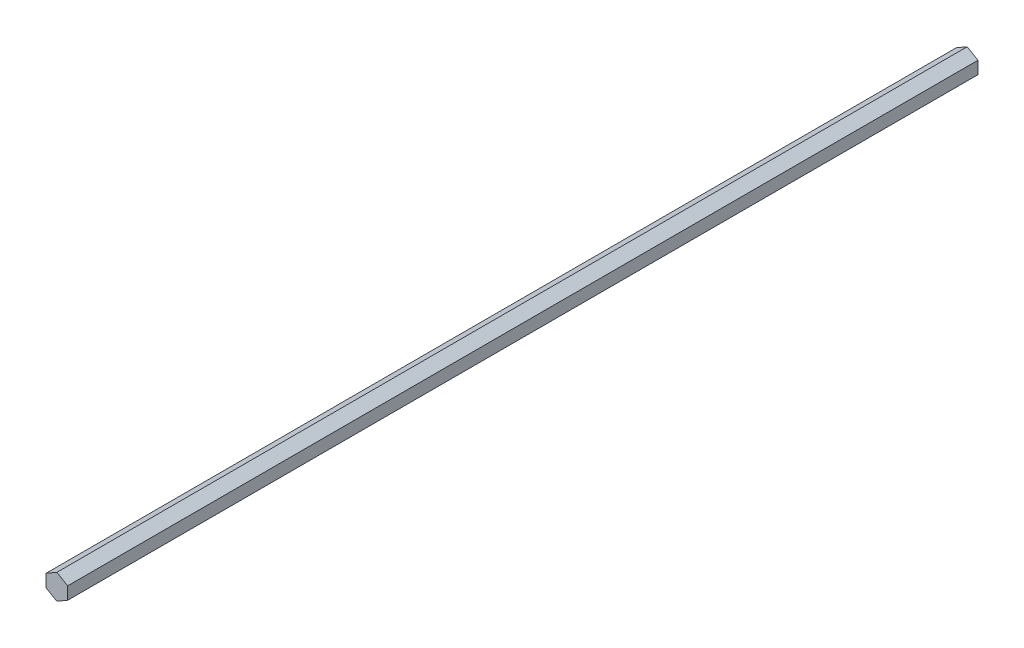
from build123d import *

# Parameters (mm, degrees)
BOSS_EXTRUDE1_DEPTH = 266.7


with BuildPart() as part:
    # Sketch3 → Boss-Extrude1 (new, symmetric)
    with BuildSketch(Plane.XY):
        Polygon((0, 7.332348419), (6.35, 3.666174209), (6.35, -3.666174209), (0, -7.332348419), (-6.35, -3.666174209), (-6.35, 3.666174209), align=None)
    extrude(amount=BOSS_EXTRUDE1_DEPTH, both=True)


solid = part.part
